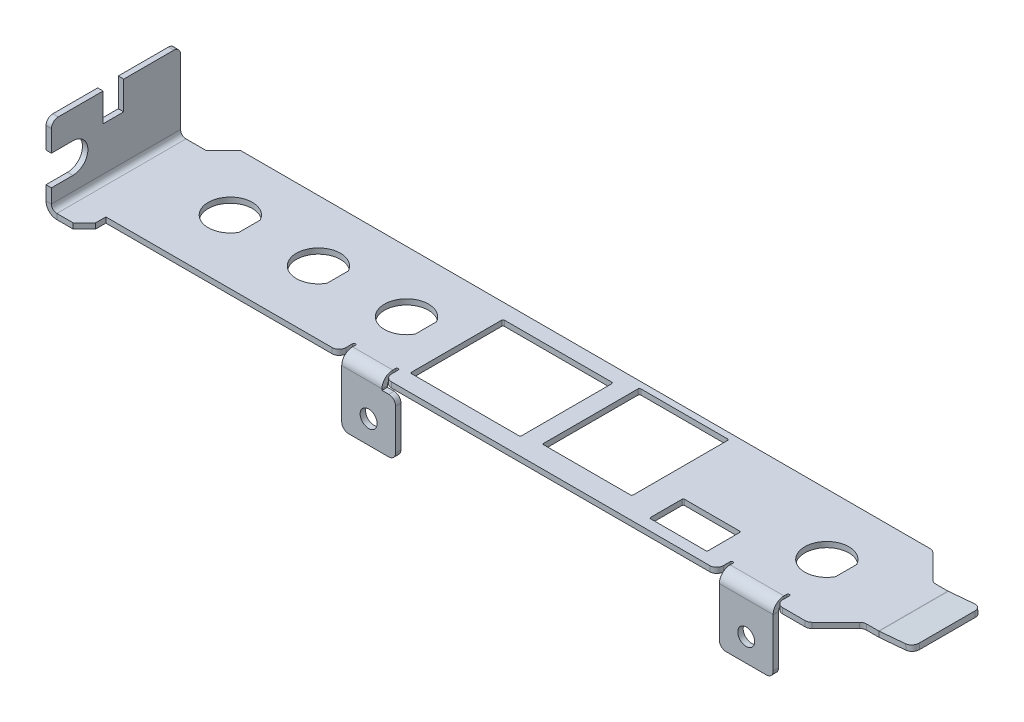
from build123d import *

# Parameters (mm, degrees)
SM_BASE_FLANGE_1_DEPTH           = 0.8
SKETCH_25_W                      = 16.240000001
SKETCH_25_H                      = 13.699999542
SKETCH_25_W_2                    = 13.2
SKETCH_25_H_2                    = 14.319999239
SKETCH_25_W_3                    = 8.5
SKETCH_25_H_3                    = 5
CUT_EXTRUDE_1_DEPTH              = 62.445396898
SM_EDGE_FLANGE_1_STRIP_CUT_DEPTH = 10.2
SM_EDGE_FLANGE_1_DEPTH           = 10.2
SM_START                         = -0.8
SM_EDGE_FLANGE_2_DEPTH           = 2.8
SM_START_2                       = 0.715504
SM_EDGE_FLANGE_2_2_OUTLINE_W     = 7.94
SM_EDGE_FLANGE_2_2_OUTLINE_H     = 0.8
SM_EDGE_FLANGE_2_2_DEPTH         = 1.284496
SM_START_3                       = -4.3519999
SM_EDGE_FLANGE_2_3_OUTLINE_W     = 7.94
SM_EDGE_FLANGE_2_3_OUTLINE_H     = 0.8
SM_EDGE_FLANGE_2_3_DEPTH         = 3.5519999
SM_START_4                       = -9
SM_EDGE_FLANGE_2_4_OUTLINE_W     = 7.94
SM_EDGE_FLANGE_2_4_OUTLINE_H     = 0.8
SM_EDGE_FLANGE_2_4_DEPTH         = 2.1479999
SM_START_5                       = 40.74
SM_EDGE_FLANGE_2_5_DEPTH         = 7.94
SM_EDGE_FLANGE_2_6_OUTLINE_W     = 2.5000002
SM_EDGE_FLANGE_2_6_OUTLINE_H     = 0.8
SM_EDGE_FLANGE_2_6_DEPTH         = 2.7199999
SM_START_6                       = 45.9600001
SM_EDGE_FLANGE_2_7_OUTLINE_W     = 2.5000002
SM_EDGE_FLANGE_2_7_OUTLINE_H     = 0.8
SM_EDGE_FLANGE_2_7_DEPTH         = 2.7199999
SM_START_7                       = 41.5557556
SM_EDGE_FLANGE_2_8_DEPTH         = 6.2856216
SM_START_8                       = 8.41
SM_EDGE_FLANGE_2_9_DEPTH         = 0.8
SM_START_9                       = -14.964
SM_EDGE_FLANGE_3_OUTLINE_W       = 8
SM_EDGE_FLANGE_3_OUTLINE_H       = 0.8
SM_EDGE_FLANGE_3_DEPTH           = 2.7199999
SM_START_10                      = -9.7439999
SM_EDGE_FLANGE_3_2_OUTLINE_W     = 8
SM_EDGE_FLANGE_3_2_OUTLINE_H     = 0.8
SM_EDGE_FLANGE_3_2_DEPTH         = 2.7199999
SM_START_11                      = -15.364
SM_EDGE_FLANGE_3_3_DEPTH         = 6.74
SM_EDGE_FLANGE_3_4_DEPTH         = 5.94
SM_EDGE_FLANGE_3_5_DEPTH         = 0.8
SM_START_12                      = -1
SM_EDGE_FLANGE_3_6_DEPTH         = 3
SM_EDGE_FLANGE_4_DEPTH           = 19.05
SM_START_13                      = 0.8
SM_EDGE_FLANGE_4_FLAT_DEPTH      = 0.8
FILLET_1_R                       = 1
FILLET_2_R                       = 0.2


with BuildPart() as part:
    # Базовая кромка1: sheet metal written as solids
    # Sketch 1 → Базовая кромка1 (new body)
    with BuildSketch(Plane(origin=(0, 0, 0), x_dir=(1, 0, 0), z_dir=(0, 1, 0))):
        Polygon((53.82, 9.21), (57.93, 5.1), (60.18, 5.1), (60.18, -5.1), (57.93, -5.1), (53.82, -9.21), (-49.76, -9.21), (-49.76, -10.74), (-51.4, -12.38), (-53.82, -12.38), (-53.82, 6.67), (-50.88, 6.67), (-48.34, 9.21), align=None)
    extrude(amount=SM_BASE_FLANGE_1_DEPTH)

    # Эскиз25 → Вырез-Вытянуть1 (cut, through all)
    with BuildSketch(Plane(origin=(0, 0.8, 0), x_dir=(1, 0, 0), z_dir=(0, 1, 0))):
        with Locations((0.744992541, 0.151324571)):
            Rectangle(SKETCH_25_W, SKETCH_25_H)
        with Locations((18.060071277, 1.126324154)):
            Rectangle(SKETCH_25_W_2, SKETCH_25_H_2)
        with Locations((33.059994901, -5.0986752)):
            Rectangle(SKETCH_25_W_3, SKETCH_25_H_3)
        with BuildLine():
            Line((-37.97, -1.352049935), (-37.97, 1.772049935))
            ThreePointArc((-37.97, 1.772049935), (-44.07, 0.21), (-37.97, -1.352049935))
        make_face()
        with BuildLine():
            Line((-24.97, -1.352049935), (-24.97, 1.772049935))
            ThreePointArc((-24.97, 1.772049935), (-31.07, 0.21), (-24.97, -1.352049935))
        make_face()
        with BuildLine():
            Line((-11.97, -1.352049935), (-11.97, 1.772049935))
            ThreePointArc((-11.97, 1.772049935), (-18.07, 0.21), (-11.97, -1.352049935))
        make_face()
        with BuildLine():
            Line((50.03, -1.352049935), (50.03, 1.772049935))
            ThreePointArc((50.03, 1.772049935), (43.93, 0.21), (50.03, -1.352049935))
        make_face()
    extrude(amount=-CUT_EXTRUDE_1_DEPTH, mode=Mode.SUBTRACT)

    # Ребро-кромка1: sheet metal written as solids
    # Ребро-кромка1 strip (on a plane across the edge) → Ребро-кромка1 strip cut (cut)
    with BuildSketch(Plane(origin=(60.18, 0.8, 5.1), x_dir=(-0.08715574274765156, 0.9961946980917461, 0), z_dir=(0, 0, -1))):
        Polygon((-1.212259082, 4.677214117), (-0.793911517, -0.104520434), (0.003044242, -0.03479584), (-0.415303324, 4.746938711), align=None)
    extrude(amount=SM_EDGE_FLANGE_1_STRIP_CUT_DEPTH, mode=Mode.SUBTRACT)

    # Ребро-кромка1 section (on a plane across the edge) → Ребро-кромка1 (add)
    with BuildSketch(Plane(origin=(60.18, 0.8, 5.1), x_dir=(-0.08715574274765156, 0.9961946980917461, 0), z_dir=(0, 0, -1))):
        with BuildLine():
            Line((-0.8, 0.034928754), (-0.8, 4.949374594))
            Line((-0.8, 4.949374594), (0, 4.949374594))
            Line((0, 4.949374594), (0, 0.034928754))
            ThreePointArc((0, 0.034928754), (0.000761423, 3.3244e-05), (0.003044242, -0.03479584))
            Line((0.003044242, -0.03479584), (-0.793911517, -0.104520434))
            ThreePointArc((-0.793911517, -0.104520434), (-0.798477155, -0.034862265), (-0.8, 0.034928754))
        make_face()
    extrude(amount=SM_EDGE_FLANGE_1_DEPTH)

    # Ребро-кромка2: read off the stored shape, not the designer's step
    # Ребро-кромка2 outline → Ребро-кромка2 (cut)
    with BuildSketch(Plane(origin=(0, 0, 0), x_dir=(1, 0, 0), z_dir=(0, 1, 0)).offset(SM_START)):
        with BuildLine():
            Line((48.68, -7.21), (48.68, -9.21))
            Line((48.68, -9.21), (49.08, -9.21))
            Line((49.08, -9.21), (49.08, -7.21))
            ThreePointArc((49.08, -7.21), (48.88, -7.01), (48.68, -7.21))
        make_face()
        with BuildLine():
            Line((40.34, -9.21), (40.74, -9.21))
            Line((40.74, -9.21), (40.74, -7.21))
            ThreePointArc((40.74, -7.21), (40.54, -7.01), (40.34, -7.21))
            Line((40.34, -7.21), (40.34, -9.21))
        make_face()
    extrude(amount=SM_EDGE_FLANGE_2_DEPTH, mode=Mode.SUBTRACT)

    # Sm Edge Flange 2 2 outline → Sm Edge Flange 2 2 (cut)
    with BuildSketch(Plane(origin=(0, 0, 0), x_dir=(1, 0, 0), z_dir=(0, 1, 0)).offset(SM_START_2)):
        with Locations((44.71, -8.81)):
            Rectangle(SM_EDGE_FLANGE_2_2_OUTLINE_W, SM_EDGE_FLANGE_2_2_OUTLINE_H)
    extrude(amount=SM_EDGE_FLANGE_2_2_DEPTH, mode=Mode.SUBTRACT)

    # Sm Edge Flange 2 5 outline → Sm Edge Flange 2 5 (cut)
    with BuildSketch(Plane.YZ.offset(SM_START_5)):
        with BuildLine():
            Line((0, 9.21), (0, 8.995640646))
            ThreePointArc((0, 8.995640646), (0.585640646, 8.41), (0.8, 7.61))
            Line((0.8, 7.61), (0.8, 8.41))
            Line((0.8, 8.41), (0.715504, 8.41))
            Line((0.715504, 8.41), (0.715504, 9.21))
            Line((0.715504, 9.21), (0, 9.21))
        make_face()
    extrude(amount=SM_EDGE_FLANGE_2_5_DEPTH, mode=Mode.SUBTRACT)



with BuildPart() as body_2:
    # Sm Edge Flange 2 3 outline → Sm Edge Flange 2 3 (new body)
    with BuildSketch(Plane(origin=(0, 0, 0), x_dir=(1, 0, 0), z_dir=(0, 1, 0)).offset(SM_START_3)):
        with Locations((44.71, -8.81)):
            Rectangle(SM_EDGE_FLANGE_2_3_OUTLINE_W, SM_EDGE_FLANGE_2_3_OUTLINE_H)
    extrude(amount=SM_EDGE_FLANGE_2_3_DEPTH)


with BuildPart() as body_3:
    # Sm Edge Flange 2 4 outline → Sm Edge Flange 2 4 (new body)
    with BuildSketch(Plane(origin=(0, 0, 0), x_dir=(1, 0, 0), z_dir=(0, 1, 0)).offset(SM_START_4)):
        with Locations((44.71, -8.81)):
            Rectangle(SM_EDGE_FLANGE_2_4_OUTLINE_W, SM_EDGE_FLANGE_2_4_OUTLINE_H)
    extrude(amount=SM_EDGE_FLANGE_2_4_DEPTH)


with BuildPart() as part_1:
    add(part.part)

    add(body_2.part)  # Sm Edge Flange 2 6 merges body 2

    add(body_3.part)  # Sm Edge Flange 2 6 merges body 3
    # Sm Edge Flange 2 6 outline → Sm Edge Flange 2 6 (add)
    with BuildSketch(Plane.YZ.offset(SM_START_5)):
        with Locations((-5.602, 8.81)):
            Rectangle(SM_EDGE_FLANGE_2_6_OUTLINE_W, SM_EDGE_FLANGE_2_6_OUTLINE_H)
        with BuildLine():
            ThreePointArc((0, 8.995640646), (-0.385889528, 9.155481322), (-0.8, 9.21))
            Line((-0.8, 9.21), (-0.8, 8.41))
            ThreePointArc((-0.8, 8.41), (-0.234314575, 8.175685425), (0, 7.61))
            Line((0, 7.61), (0, 8.995640646))
        make_face()
    extrude(amount=SM_EDGE_FLANGE_2_6_DEPTH)

    # Sm Edge Flange 2 7 outline → Sm Edge Flange 2 7 (add)
    with BuildSketch(Plane.YZ.offset(SM_START_6)):
        with Locations((-5.602, 8.81)):
            Rectangle(SM_EDGE_FLANGE_2_7_OUTLINE_W, SM_EDGE_FLANGE_2_7_OUTLINE_H)
        with BuildLine():
            ThreePointArc((0, 8.995640646), (-0.385889528, 9.155481322), (-0.8, 9.21))
            Line((-0.8, 9.21), (-0.8, 8.41))
            ThreePointArc((-0.8, 8.41), (-0.234314575, 8.175685425), (0, 7.61))
            Line((0, 7.61), (0, 8.995640646))
        make_face()
    extrude(amount=SM_EDGE_FLANGE_2_7_DEPTH)

    # Sm Edge Flange 2 8 outline → Sm Edge Flange 2 8 (add)
    with BuildSketch(Plane.YZ.offset(SM_START_7)):
        with BuildLine():
            ThreePointArc((0, 8.995640646), (-0.385889528, 9.155481322), (-0.8, 9.21))
            Line((-0.8, 9.21), (-0.8, 8.41))
            ThreePointArc((-0.8, 8.41), (-0.234314575, 8.175685425), (0, 7.61))
            Line((0, 7.61), (0, 8.995640646))
        make_face()
    extrude(amount=SM_EDGE_FLANGE_2_8_DEPTH)

    # Sm Edge Flange 2 9 outline → Sm Edge Flange 2 9 (add)
    with BuildSketch(Plane.XY.offset(SM_START_8)):
        with BuildLine():
            Line((45.9600001, -6.8520001), (45.96, -5.602))
            ThreePointArc((45.96, -5.602), (45.593883476, -6.485883476), (44.71, -6.852))
            Line((44.71, -6.852), (45.9600001, -6.8520001))
        make_face()
        with BuildLine():
            ThreePointArc((44.71, -4.352), (45.593883476, -4.718116524), (45.96, -5.602))
            Line((45.96, -5.602), (45.9600001, -4.3519999))
            Line((45.9600001, -4.3519999), (44.71, -4.352))
        make_face()
        with BuildLine():
            ThreePointArc((43.46, -5.602), (43.826116524, -4.718116524), (44.71, -4.352))
            Line((44.71, -4.352), (43.4599999, -4.3519999))
            Line((43.4599999, -4.3519999), (43.46, -5.602))
        make_face()
        with BuildLine():
            Line((43.4599999, -6.8520001), (44.71, -6.852))
            ThreePointArc((44.71, -6.852), (43.826116524, -6.485883476), (43.46, -5.602))
            Line((43.46, -5.602), (43.4599999, -6.8520001))
        make_face()
    extrude(amount=SM_EDGE_FLANGE_2_9_DEPTH)

    # Sm Edge Flange 3 3 outline → Sm Edge Flange 3 3 (cut)
    with BuildSketch(Plane.YZ.offset(SM_START_11)):
        with BuildLine():
            Line((0, 9.21), (0, 8.995640646))
            ThreePointArc((0, 8.995640646), (0.585640646, 8.41), (0.8, 7.61))
            Line((0.8, 7.61), (0.8, 9.21))
            Line((0.8, 9.21), (0, 9.21))
        make_face()
    extrude(amount=SM_EDGE_FLANGE_3_3_DEPTH, mode=Mode.SUBTRACT)



with BuildPart() as body_2_2:
    # Ребро-кромка3: read off the stored shape, not the designer's step
    # Ребро-кромка3 outline → Ребро-кромка3 (new body)
    with BuildSketch(Plane.YZ.offset(SM_START_9)):
        with Locations((-5, 8.81)):
            Rectangle(SM_EDGE_FLANGE_3_OUTLINE_W, SM_EDGE_FLANGE_3_OUTLINE_H)
    extrude(amount=SM_EDGE_FLANGE_3_DEPTH)


with BuildPart() as body_3_2:
    # Sm Edge Flange 3 2 outline → Sm Edge Flange 3 2 (new body)
    with BuildSketch(Plane.YZ.offset(SM_START_10)):
        with Locations((-5, 8.81)):
            Rectangle(SM_EDGE_FLANGE_3_2_OUTLINE_W, SM_EDGE_FLANGE_3_2_OUTLINE_H)
    extrude(amount=SM_EDGE_FLANGE_3_2_DEPTH)


with BuildPart() as part_2:
    add(part_1.part)

    add(body_2_2.part)  # Sm Edge Flange 3 4 merges body 2 2

    add(body_3_2.part)  # Sm Edge Flange 3 4 merges body 3 2
    # Sm Edge Flange 3 4 outline → Sm Edge Flange 3 4 (add)
    with BuildSketch(Plane.YZ.offset(SM_START_9)):
        with BuildLine():
            Line((-0.8, 9.21), (-1, 9.21))
            Line((-1, 9.21), (-1, 8.41))
            Line((-1, 8.41), (-0.8, 8.41))
            ThreePointArc((-0.8, 8.41), (-0.234314575, 8.175685425), (0, 7.61))
            Line((0, 7.61), (0, 8.995640646))
            ThreePointArc((0, 8.995640646), (-0.385889528, 9.155481322), (-0.8, 9.21))
        make_face()
    extrude(amount=SM_EDGE_FLANGE_3_4_DEPTH)

    # Sm Edge Flange 3 5 outline → Sm Edge Flange 3 5 (add)
    with BuildSketch(Plane.XY.offset(SM_START_8)):
        with BuildLine():
            Line((-9.7439999, -9), (-9.744, -5.602))
            ThreePointArc((-9.744, -5.602), (-10.994, -6.852), (-12.244, -5.602))
            Line((-12.244, -5.602), (-12.2440001, -9))
            Line((-12.2440001, -9), (-9.7439999, -9))
        make_face()
        with BuildLine():
            ThreePointArc((-12.244, -5.602), (-10.994, -4.352), (-9.744, -5.602))
            Line((-9.744, -5.602), (-9.7439999, -1))
            Line((-9.7439999, -1), (-12.2440001, -1))
            Line((-12.2440001, -1), (-12.244, -5.602))
        make_face()
    extrude(amount=SM_EDGE_FLANGE_3_5_DEPTH)

    # Sm Edge Flange 3 6 outline → Sm Edge Flange 3 6 (cut)
    with BuildSketch(Plane(origin=(0, 0, 0), x_dir=(1, 0, 0), z_dir=(0, 1, 0)).offset(SM_START_12)):
        with BuildLine():
            Line((-14.964, -9), (-14.964, -7.21))
            ThreePointArc((-14.964, -7.21), (-15.164, -7.01), (-15.364, -7.21))
            Line((-15.364, -7.21), (-15.364, -9))
            Line((-15.364, -9), (-14.964, -9))
        make_face()
        with BuildLine():
            Line((-9.024, -7.21), (-9.024, -9))
            Line((-9.024, -9), (-8.624, -9))
            Line((-8.624, -9), (-8.624, -7.21))
            ThreePointArc((-8.624, -7.21), (-8.824, -7.01), (-9.024, -7.21))
        make_face()
    extrude(amount=SM_EDGE_FLANGE_3_6_DEPTH, mode=Mode.SUBTRACT)

    # Ребро-кромка4: sheet metal written as solids
    # Ребро-кромка4 bend section (on a plane across the edge) → Ребро-кромка4 (add)
    with BuildSketch(Plane(origin=(-54.62, 0.8, -6.67), x_dir=(1, 0, 0), z_dir=(0, 0, 1))):
        with BuildLine():
            Line((-0.8, 0.8), (0, 0.8))
            ThreePointArc((0, 0.8), (0.234314575, 0.234314575), (0.8, 0))
            Line((0.8, 0), (0.8, -0.8))
            ThreePointArc((0.8, -0.8), (-0.33137085, -0.33137085), (-0.8, 0.8))
        make_face()
    extrude(amount=SM_EDGE_FLANGE_4_DEPTH)

    # Ребро-кромка4 profile (on flange) → Ребро-кромка4 flat (add)
    with BuildSketch(Plane(origin=(-54.62, 0.8, 0), x_dir=(0, 0, 1), z_dir=(-1, 0, 0)).offset(SM_START_13)):
        with BuildLine():
            Line((-6.67, 11.43), (-6.67, 0.8))
            Line((-6.67, 0.8), (12.38, 0.8))
            Line((12.38, 0.8), (12.38, 2.87))
            Line((12.38, 2.87), (9.21, 2.87))
            ThreePointArc((9.21, 2.87), (7, 5.08), (9.21, 7.29))
            Line((9.21, 7.29), (12.38, 7.29))
            Line((12.38, 7.29), (12.38, 11.43))
            Line((12.38, 11.43), (4.76, 11.43))
            Line((4.76, 11.43), (4.76, 7.24))
            Line((4.76, 7.24), (1.71, 7.24))
            Line((1.71, 7.24), (1.71, 11.43))
            Line((1.71, 11.43), (-6.67, 11.43))
        make_face()
    extrude(amount=-SM_EDGE_FLANGE_4_FLAT_DEPTH)

    # Скругление1
    fillet_1_edges = [part_2.edges().sort_by_distance(p)[0] for p in [
        (65.145403026, 0.83288854, 5.1),
        (65.145403026, 0.83288854, -5.1),
        (40.34, 0.4, 9.21),
        (49.08, 0.4, 9.21),
        (48.68, -9, 8.81),
        (40.74, -9, 8.81),
        (53.82, 0.4, -9.21),
        (57.93, 0.4, -5.1),
        (57.93, 0.4, 5.1),
        (53.82, 0.4, 9.21),
        (-15.364, 0.4, 9.21),
        (-8.624, 0.4, 9.21),
        (-14.964, -9, 8.81),
        (-7.024, -9, 8.81),
        (-7.024, -1, 8.81),
        (-55.02, 12.23, -6.67),
        (-55.02, 12.23, 12.38),
    ]]
    fillet(fillet_1_edges, radius=FILLET_1_R)

    # Скругление2
    fillet_2_edges = [part_2.edges().sort_by_distance(p)[0] for p in [
        (-7.37500746, 0.4, 6.6986752),
        (-7.37500746, 0.4, -7.001324342),
        (8.864992541, 0.4, -7.001324342),
        (8.864992541, 0.4, 6.6986752),
        (11.460071277, 0.4, 6.033675466),
        (11.460071277, 0.4, -8.286323773),
        (24.660071277, 0.4, -8.286323773),
        (24.660071277, 0.4, 6.033675466),
        (37.309994901, 0.4, 2.5986752),
        (37.309994901, 0.4, 7.5986752),
        (28.809994901, 0.4, 7.5986752),
        (28.809994901, 0.4, 2.5986752),
    ]]
    fillet(fillet_2_edges, radius=FILLET_2_R)


solid = part_2.part
